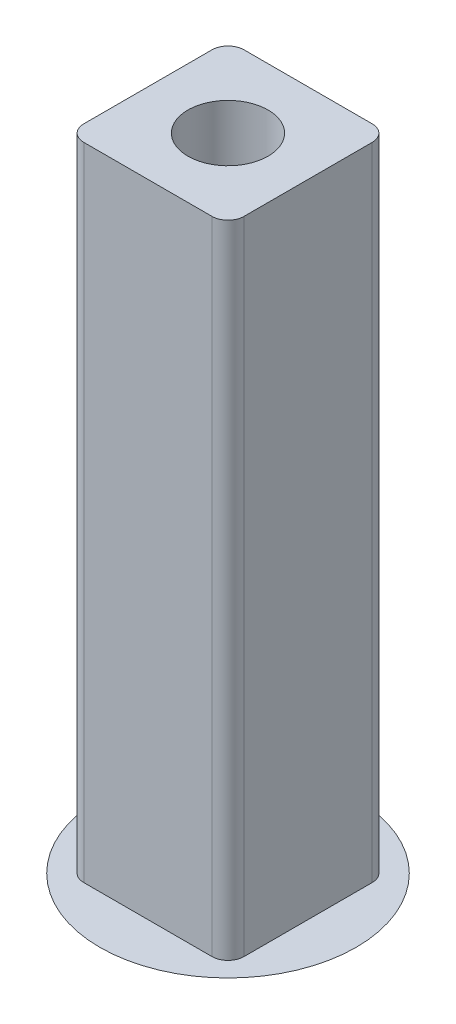
from build123d import *

# Parameters (mm, degrees)
SKETCH_1_R      = 1.25
EXTRUDE_1_DEPTH = 20


with BuildPart() as part:
    # Эскиз1 → Бобышка-Вытянуть1 (new body)
    with BuildSketch(Plane(origin=(0, 0, 0), x_dir=(1, 0, 0), z_dir=(0, 1, 0))):
        with BuildLine():
            Line((-2, -2.5), (2, -2.5))
            ThreePointArc((2, -2.5), (2.353553391, -2.353553391), (2.5, -2))
            Line((2.5, -2), (2.5, 2))
            ThreePointArc((2.5, 2), (2.353553391, 2.353553391), (2, 2.5))
            Line((2, 2.5), (-2, 2.5))
            ThreePointArc((-2, 2.5), (-2.353553391, 2.353553391), (-2.5, 2))
            Line((-2.5, 2), (-2.5, -2))
            ThreePointArc((-2.5, -2), (-2.353553391, -2.353553391), (-2, -2.5))
        make_face()
        Circle(SKETCH_1_R, mode=Mode.SUBTRACT)
    extrude(amount=EXTRUDE_1_DEPTH)

    # Бобышка-Вытянуть2 cone 1 section (through the dimple's axis) → Бобышка-Вытянуть2 (revolve)
    with BuildSketch(Plane(origin=(0, 0, 0), x_dir=(0, 0, 1), z_dir=(1, 0, 0))):
        Polygon((0, 0), (4, 0), (0, 1.950930354), align=None)
    revolve(axis=Axis((0, 0, 0), (0, -1, 0)))


solid = part.part
